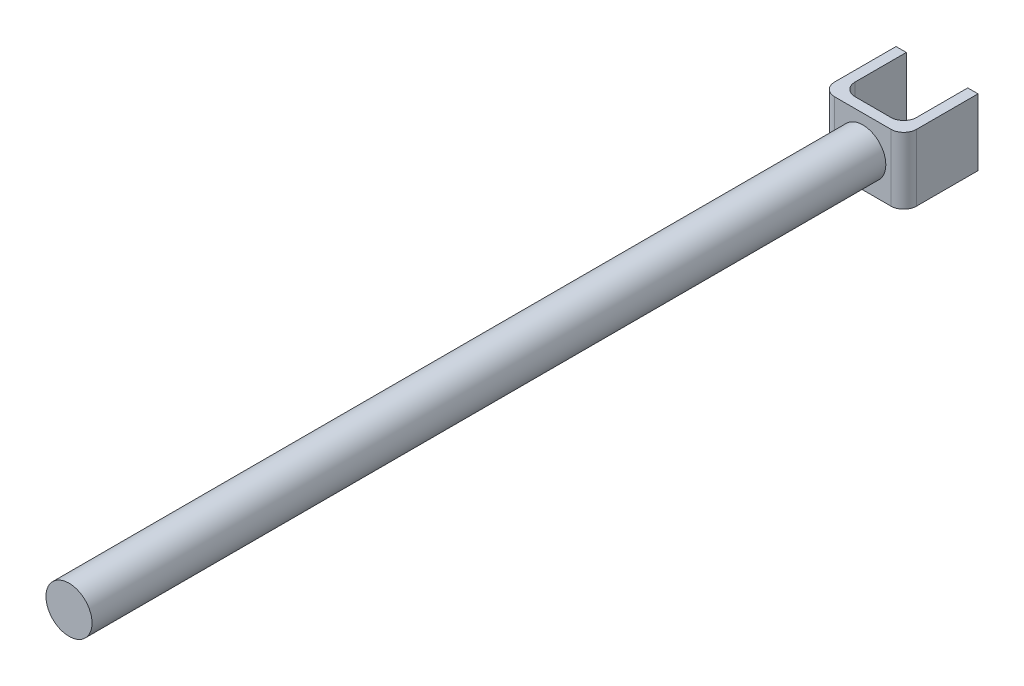
from build123d import *

# Parameters (mm, degrees)
BOSS_EXTRUDE1_DEPTH      = 13
BOSS_EXTRUDE1_DEPTH_BACK = 13
SKETCH2_R                = 9
BOSS_EXTRUDE2_DEPTH      = 310


with BuildPart() as part:
    # Sketch1 → Boss-Extrude1 (new, two sides: drawn at the far end of the back side and taken through both)
    with BuildSketch(Plane(origin=(0, 0, 0), x_dir=(1, 0, 0), z_dir=(0, 1, 0)).offset(-BOSS_EXTRUDE1_DEPTH_BACK)):
        with BuildLine():
            Line((7, -20.776256957), (-7, -20.776256957))
            ThreePointArc((-7, -20.776256957), (-10.535533906, -19.311790863), (-12, -15.776256957))
            Line((-12, -15.776256957), (-12, 4.223743043))
            Line((-12, 4.223743043), (-16, 4.223743043))
            Line((-16, 4.223743043), (-16, -19.776256957))
            ThreePointArc((-16, -19.776256957), (-14.535533906, -23.311790863), (-11, -24.776256957))
            Line((-11, -24.776256957), (11, -24.776256957))
            ThreePointArc((11, -24.776256957), (14.535533906, -23.311790863), (16, -19.776256957))
            Line((16, -19.776256957), (16, 4.223743043))
            Line((16, 4.223743043), (12, 4.223743043))
            Line((12, 4.223743043), (12, -15.776256957))
            ThreePointArc((12, -15.776256957), (10.535533906, -19.311790863), (7, -20.776256957))
        make_face()
    extrude(amount=BOSS_EXTRUDE1_DEPTH + BOSS_EXTRUDE1_DEPTH_BACK)

    # Sketch2 → Boss-Extrude2 (add)
    with BuildSketch(Plane.XY.offset(24.776256957)):
        Circle(SKETCH2_R)
    extrude(amount=BOSS_EXTRUDE2_DEPTH)


solid = part.part
